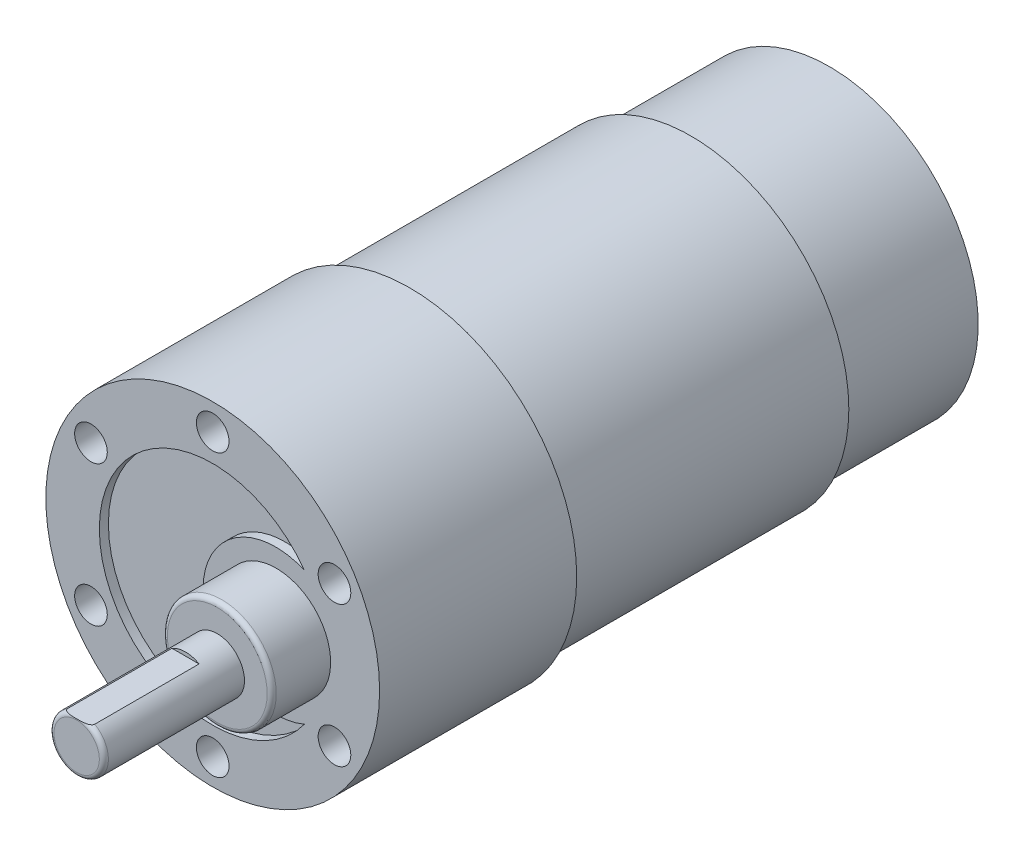
from build123d import *

# Parameters (mm, degrees)
SKETCH1_R            = 18.4
BOSS_EXTRUDE1_DEPTH  = 21.73
SKETCH2_R            = 17.4
BOSS_EXTRUDE2_DEPTH  = 31
SKETCH3_R            = 6
BOSS_EXTRUDE3_DEPTH  = 6.5
FILLET1_R            = 0.5
SKETCH4_R            = 3
BOSS_EXTRUDE4_DEPTH  = 15.5
CUT_EXTRUDE1_START   = -12
CUT_EXTRUDE1_DEPTH   = 12
CUT_EXTRUDE2_DEPTH   = 1
SKETCH9_R            = 4
BOSS_EXTRUDE5_DEPTH  = 1
FILLET2_R            = 0.5
SKETCH10_R           = 14
BOSS_EXTRUDE6_DEPTH  = 1.5
SKETCH11_W           = 3.5
SKETCH11_H           = 1
BOSS_EXTRUDE7_DEPTH  = 5.6
FILLET3_R            = 0.5
SKETCH13_R           = 9
BOSS_EXTRUDE8_DEPTH  = 3
SKETCH14_R           = 1.5
BOSS_EXTRUDE9_DEPTH  = 8.55
FILLET4_R            = 0.5
SKETCH15_R           = 16.4
BOSS_EXTRUDE10_DEPTH = 15.26
SKETCH17_R           = 1.8
CUT_EXTRUDE3_DEPTH   = 3


with BuildPart() as part:
    # Sketch1 → Boss-Extrude1 (new body)
    with BuildSketch(Plane.XY):
        Circle(SKETCH1_R)
    extrude(amount=BOSS_EXTRUDE1_DEPTH)

    # Sketch2 → Boss-Extrude2 (add)
    with BuildSketch(Plane(origin=(0, 0, 0), x_dir=(-1, 0, 0), z_dir=(0, 0, -1))):
        with Locations(Location((0, 0, 0), (0, 0, 180))):
            Circle(SKETCH2_R)
    extrude(amount=BOSS_EXTRUDE2_DEPTH)

    # Sketch3 → Boss-Extrude3 (add)
    with BuildSketch(Plane.XY.offset(21.73)):
        with Locations(Location((7, 0, 0), (0, 0, 180))):
            Circle(SKETCH3_R)
    extrude(amount=BOSS_EXTRUDE3_DEPTH)

    # Fillet1
    fillet1_edges = [part.edges().sort_by_distance(p)[0] for p in [
        (13, 0, 28.23),
    ]]
    fillet(fillet1_edges, radius=FILLET1_R)

    # Sketch4 → Boss-Extrude4 (add)
    with BuildSketch(Plane.XY.offset(28.23)):
        with Locations((7, 0)):
            Circle(SKETCH4_R)
    extrude(amount=BOSS_EXTRUDE4_DEPTH)

    # Sketch5 → Cut-Extrude1 (cut)
    with BuildSketch(Plane.XY.offset(43.73).offset(CUT_EXTRUDE1_START)):
        with BuildLine():
            Line((5.503337045, 2.6), (8.496662955, 2.6))
            ThreePointArc((8.496662955, 2.6), (7, 3), (5.503337045, 2.6))
        make_face()
    extrude(amount=CUT_EXTRUDE1_DEPTH, mode=Mode.SUBTRACT)

    # Sketch8 → Cut-Extrude2 (cut)
    with BuildSketch(Plane.XY.offset(21.73)):
        with BuildLine():
            ThreePointArc((10.116155685, 7.342574083), (-12.5, 0), (10.116155685, -7.342574083))
            ThreePointArc((10.116155685, -7.342574083), (-1.05978604, 0), (10.116155685, 7.342574083))
        make_face()
    extrude(amount=-CUT_EXTRUDE2_DEPTH, mode=Mode.SUBTRACT)

    # Sketch9 → Boss-Extrude5 (add)
    with BuildSketch(Plane(origin=(0, 0, -31), x_dir=(-1, 0, 0), z_dir=(0, 0, -1))):
        Circle(SKETCH9_R)
    extrude(amount=BOSS_EXTRUDE5_DEPTH)

    # Fillet2
    fillet2_edges = [part.edges().sort_by_distance(p)[0] for p in [
        (4, 0, -32),
    ]]
    fillet(fillet2_edges, radius=FILLET2_R)

    # Sketch11 → Boss-Extrude7 (add)
    with BuildSketch(Plane(origin=(0, 0, -31), x_dir=(-1, 0, 0), z_dir=(0, 0, -1))):
        with Locations((0, 12.05)):
            Rectangle(SKETCH11_W, SKETCH11_H)
        with Locations((0, -12.05)):
            Rectangle(SKETCH11_W, SKETCH11_H)
    extrude(amount=BOSS_EXTRUDE7_DEPTH)

    # Fillet3
    fillet3_edges = [part.edges().sort_by_distance(p)[0] for p in [
        (1.75, 12.05, -36.6),
        (-1.75, 12.05, -36.6),
        (-1.75, -12.05, -36.6),
        (1.75, -12.05, -36.6),
    ]]
    fillet(fillet3_edges, radius=FILLET3_R)

    # Sketch14 → Boss-Extrude9 (add)
    with BuildSketch(Plane(origin=(0, 0, -32), x_dir=(-1, 0, 0), z_dir=(0, 0, -1))):
        Circle(SKETCH14_R)
    extrude(amount=BOSS_EXTRUDE9_DEPTH)

    # Fillet4
    # the kernel refuses this fillet: 0.5 mm, written as the material it takes off along each edge
    with BuildSketch(Plane(origin=(7, 0, 43.73), x_dir=(0.4622655728594592, 0.8867415295050277, 0), z_dir=(0.8867415295050277, -0.4622655728594592, 0))) as fillet4_piece_1:
        with BuildLine():
            CenterArc((3 - FILLET4_R, -FILLET4_R), FILLET4_R, 0, 90)
            Line((3 - FILLET4_R, 0), (3 - FILLET4_R, FILLET4_R * 0.02))
            Line((3 - FILLET4_R, FILLET4_R * 0.02), (3 + FILLET4_R * 0.02, FILLET4_R * 0.02))
            Line((3 + FILLET4_R * 0.02, FILLET4_R * 0.02), (3 + FILLET4_R * 0.02, -FILLET4_R))
            Line((3 + FILLET4_R * 0.02, -FILLET4_R), (3, -FILLET4_R))
        make_face()
    revolve(axis=Axis((7, 0, 43.73), (0, 0, 1)), revolution_arc=297.533397677, mode=Mode.SUBTRACT)
    with BuildSketch(Plane(origin=(7, 0, 43.73), x_dir=(1, 0, 0), z_dir=(0, -1, 0))) as fillet4_piece_2:
        with BuildLine():
            CenterArc((3 - FILLET4_R, -FILLET4_R), FILLET4_R, 0, 90)
            Line((3 - FILLET4_R, 0), (3 - FILLET4_R, FILLET4_R * 0.02))
            Line((3 - FILLET4_R, FILLET4_R * 0.02), (3 + FILLET4_R * 0.02, FILLET4_R * 0.02))
            Line((3 + FILLET4_R * 0.02, FILLET4_R * 0.02), (3 + FILLET4_R * 0.02, -FILLET4_R))
            Line((3 + FILLET4_R * 0.02, -FILLET4_R), (3, -FILLET4_R))
        make_face()
    revolve(axis=Axis((7, 0, 43.73), (0, 0, 1)), revolution_arc=117.379597562, mode=Mode.SUBTRACT)



with BuildPart() as body_2:
    # Sketch10 → Boss-Extrude6 (new body)
    with BuildSketch(Plane(origin=(0, 0, -34), x_dir=(-1, 0, 0), z_dir=(0, 0, -1))):
        Circle(SKETCH10_R)
    extrude(amount=BOSS_EXTRUDE6_DEPTH)


with BuildPart() as body_3:
    # Sketch13 → Boss-Extrude8 (new body)
    with BuildSketch(Plane(origin=(0, 0, -37.5), x_dir=(-1, 0, 0), z_dir=(0, 0, -1))):
        Circle(SKETCH13_R)
    extrude(amount=BOSS_EXTRUDE8_DEPTH)


with BuildPart() as part_1:
    add(part.part)

    add(body_2.part)  # Boss-Extrude10 merges body 2

    add(body_3.part)  # Boss-Extrude10 merges body 3
    # Sketch15 → Boss-Extrude10 (add)
    with BuildSketch(Plane(origin=(0, 0, -31), x_dir=(-1, 0, 0), z_dir=(0, 0, -1))):
        Circle(SKETCH15_R)
    extrude(amount=BOSS_EXTRUDE10_DEPTH)

    # Sketch17 → Cut-Extrude3 (cut)
    with BuildSketch(Plane.XY.offset(21.73)):
        with Locations((0, -15.5)):
            Circle(SKETCH17_R)
        with Locations((-13.423393759, -7.75)):
            Circle(SKETCH17_R)
        with Locations((-13.423393759, 7.75)):
            Circle(SKETCH17_R)
        with Locations((0, 15.5)):
            Circle(SKETCH17_R)
        with Locations((13.423393759, 7.75)):
            Circle(SKETCH17_R)
        with Locations((13.423393759, -7.75)):
            Circle(SKETCH17_R)
    extrude(amount=-CUT_EXTRUDE3_DEPTH, mode=Mode.SUBTRACT)


solid = part_1.part
